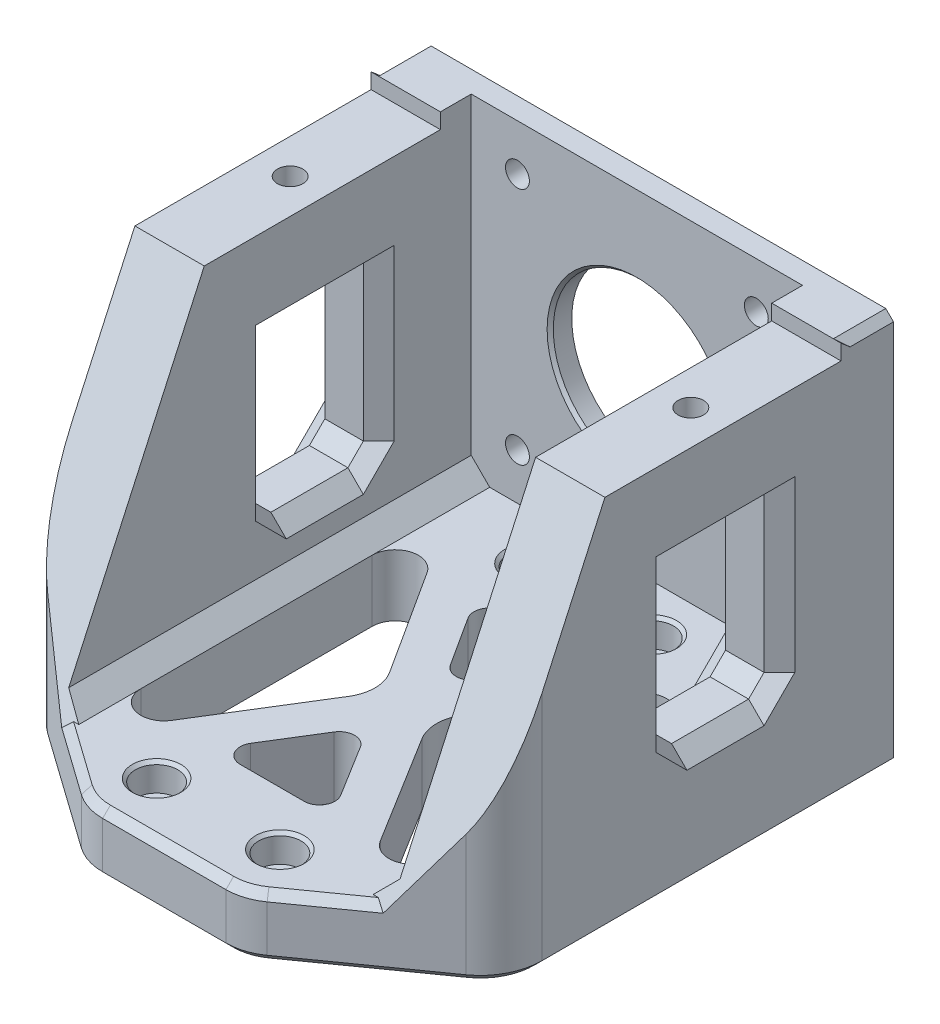
from build123d import *

# Parameters (mm, degrees)
SKETCH1_W               = 42.99999999999999
SKETCH1_H               = 43.00000000000001
SKETCH1_R               = 11.250000000000002
SKETCH1_R_2             = 1.5500000000000034
SKETCH1_R_3             = 1.5500000000000018
SKETCH1_R_4             = 1.5499999999999992
SKETCH1_R_5             = 1.5500000000000012
BOSS_EXTRUDE1_DEPTH     = 2.8
SKETCH2_R               = 1.5499999999999992
SKETCH2_R_2             = 1.5500000000000005
SKETCH2_R_3             = 1.5500000000000034
SKETCH2_R_4             = 1.5500000000000018
BOSS_EXTRUDE2_DEPTH     = 8
SKETCH3_R               = 2.75
SKETCH3_R_2             = 2.749999999999998
SKETCH3_R_3             = 2.7500000000000044
SKETCH3_R_4             = 2.7500000000000036
CUT_EXTRUDE1_DEPTH      = 3.6
SKETCH4_W               = 13.999999999999996
SKETCH4_H               = 24
BOSS_EXTRUDE3_DEPTH     = 9
CUT_EXTRUDE3_DEPTH      = 92.05990830217213
CHAMFER1_SIZE           = 2.4
BOSS_EXTRUDE4_START     = -21.5
BOSS_EXTRUDE4_DEPTH     = 43
SKETCH5_R               = 1.6499999999999986
SKETCH5_R_2             = 1.6500000000000061
CUT_EXTRUDE2_DEPTH      = 18
CUT_EXTRUDE4_DEPTH      = 2.8
CHAMFER2_SIZE           = 1
CHAMFER3_SIZE           = 1
FILLET1_R               = 2
CHAMFER4_SIZE           = 2
CHAMFER5_SIZE           = 0.4
CHAMFER6_SIZE           = 0.4
CUT_EXTRUDE5_DEPTH      = 92.05990830217213
CUT_EXTRUDE5_DEPTH_BACK = 92.05990830217213


# Read off the part's stored shape, not the designer's step: Mirror1
with BuildPart() as part:
    # Sketch1 → Boss-Extrude1 (new body)
    with BuildSketch(Plane.XY):
        with Locations((0, 29.500000000000004)):
            Rectangle(SKETCH1_W, SKETCH1_H)
        with Locations((0, 29.5)):
            Circle(SKETCH1_R, mode=Mode.SUBTRACT)
        with Locations((-15.5, 45)):
            Circle(SKETCH1_R_2, mode=Mode.SUBTRACT)
        with Locations((15.5, 45)):
            Circle(SKETCH1_R_3, mode=Mode.SUBTRACT)
        with Locations((-15.5, 14.000000000000005)):
            Circle(SKETCH1_R_4, mode=Mode.SUBTRACT)
        with Locations((15.5, 14.000000000000005)):
            Circle(SKETCH1_R_5, mode=Mode.SUBTRACT)
    extrude(amount=BOSS_EXTRUDE1_DEPTH)

    # Sketch2 → Boss-Extrude2 (add)
    with BuildSketch(Plane(origin=(0, 0, 0), x_dir=(1, 0, 0), z_dir=(0, 1, 0))):
        with BuildLine():
            Line((-21.499999999999996, 0), (21.499999999999996, 0))
            Line((21.499999999999996, 0), (21.5, -56.13000000000001))
            Line((21.5, -56.13000000000001), (12.052422437019597, -62.83770289976113))
            ThreePointArc((12.052422437019597, -62.83770289976113), (10.126743955166411, -63.79910489864743), (8.000000000000245, -64.12999999999994))
            Line((8.000000000000245, -64.12999999999994), (-7.999999999999807, -64.13))
            ThreePointArc((-7.999999999999807, -64.13), (-10.126743955165974, -63.7991048986475), (-12.052422437019167, -62.83770289976122))
            Line((-12.052422437019167, -62.83770289976122), (-21.49999999999961, -56.13000000000015))
            Line((-21.49999999999961, -56.13000000000015), (-21.499999999999996, 0))
        make_face()
        with Locations(Location((8.00000000000003, -8.800000000000002, 0), (0, 0, 270))):
            Circle(SKETCH2_R, mode=Mode.SUBTRACT)
        with Locations(Location((-7.999999999999971, -8.800000000000054, 0), (0, 0, 270))):
            Circle(SKETCH2_R_2, mode=Mode.SUBTRACT)
        with Locations(Location((-7.999999999999804, -57.13000000000005, 0), (0, 0, 270))):
            Circle(SKETCH2_R_3, mode=Mode.SUBTRACT)
        with Locations(Location((8.000000000000195, -57.13, 0), (0, 0, 270))):
            Circle(SKETCH2_R_4, mode=Mode.SUBTRACT)
        with BuildLine():
            Line((13.57707837001736, -16.445166557918895), (4.795130616695724, -30.094621381516244))
            ThreePointArc((4.795130616695724, -30.094621381516244), (4.000189021604087, -32.75652379604577), (4.748720395176192, -35.43184758707804))
            Line((4.748720395176192, -35.43184758707804), (13.549232237105649, -49.64750228125598))
            ThreePointArc((13.549232237105649, -49.64750228125598), (16.92088266863083, -50.95390090181981), (19.099999999999994, -48.06839372900919))
            Line((19.099999999999994, -48.06839372900919), (19.099999999999994, -18.06839372900918))
            ThreePointArc((19.099999999999994, -18.06839372900918), (16.945941815390423, -15.190133413302142), (13.57707837001736, -16.445166557918895))
        make_face(mode=Mode.SUBTRACT)
        with BuildLine():
            Line((5.825834789666343, -18.882151447393497), (1.681947753321832, -25.32284097156898))
            ThreePointArc((1.681947753321832, -25.32284097156898), (8.95e-14, -26.24068952417545), (-1.6819477533216585, -25.32284097156899))
            Line((-1.6819477533216585, -25.32284097156899), (-5.825834789666213, -18.88215144739354))
            ThreePointArc((-5.825834789666213, -18.88215144739354), (-5.899492757283408, -16.84195587126352), (-4.14388703634448, -15.800000000000026))
            Line((-4.14388703634448, -15.800000000000026), (4.143887036344589, -15.799999999999999))
            ThreePointArc((4.143887036344589, -15.799999999999999), (5.899492757283525, -16.841955871263476), (5.825834789666343, -18.882151447393497))
        make_face(mode=Mode.SUBTRACT)
        with BuildLine():
            Line((1.7005118419297098, -40.38700274513657), (5.844398878274272, -47.080711958695154))
            ThreePointArc((5.844398878274272, -47.080711958695154), (5.891095963414161, -49.10672431853265), (4.143887036344701, -50.13345099352635))
            Line((4.143887036344701, -50.13345099352635), (-4.14388703634435, -50.13345099352636))
            ThreePointArc((-4.14388703634435, -50.13345099352636), (-5.891095963413801, -49.10672431853265), (-5.844398878273922, -47.08071195869517))
            Line((-5.844398878273922, -47.08071195869517), (-1.7005118419294287, -40.387002745136584))
            ThreePointArc((-1.7005118419294287, -40.387002745136584), (1.3517e-13, -39.43974177996776), (1.7005118419297098, -40.38700274513657))
        make_face(mode=Mode.SUBTRACT)
        with BuildLine():
            Line((-4.748720395175949, -35.431847587078074), (-13.54923223710531, -49.64750228125607))
            ThreePointArc((-13.54923223710531, -49.64750228125607), (-16.920882668630473, -50.953900901819914), (-19.099999999999664, -48.06839372900932))
            Line((-19.099999999999664, -48.06839372900932), (-19.09999999999987, -18.068393729009312))
            ThreePointArc((-19.09999999999987, -18.068393729009312), (-16.945941815390317, -15.190133413302267), (-13.577078370017249, -16.445166557918988))
            Line((-13.577078370017249, -16.445166557918988), (-4.795130616695517, -30.094621381516276))
            ThreePointArc((-4.795130616695517, -30.094621381516276), (-4.000189021603861, -32.7565237960458), (-4.748720395175949, -35.431847587078074))
        make_face(mode=Mode.SUBTRACT)
    extrude(amount=BOSS_EXTRUDE2_DEPTH)

    # Sketch3 → Cut-Extrude1 (cut)
    with BuildSketch(Plane(origin=(0, 8, 0), x_dir=(1, 0, 0), z_dir=(0, 1, 0))):
        with Locations(Location((-7.999999999999971, -8.800000000000054, 0), (0, 0, 270))):
            Circle(SKETCH3_R)
        with Locations(Location((8.00000000000003, -8.800000000000002, 0), (0, 0, 270))):
            Circle(SKETCH3_R_2)
        with Locations(Location((-7.999999999999804, -57.13000000000005, 0), (0, 0, 270))):
            Circle(SKETCH3_R_3)
        with Locations(Location((8.000000000000195, -57.13, 0), (0, 0, 270))):
            Circle(SKETCH3_R_4)
    extrude(amount=-CUT_EXTRUDE1_DEPTH, mode=Mode.SUBTRACT)

    # Sketch4 → Boss-Extrude3 (add)
    # profile 1 of 2: a face of its own
    with BuildSketch(Plane(origin=(21.499999999999996, 0, 0), x_dir=(0, 0, -1), z_dir=(1, 0, 0))):
        Polygon((-2.8, 8), (-2.8, 51), (-6.800000000000001, 51), (-13.799999999999999, 56.99999999999999), (-33.8, 56.99999999999999), (-56.13000000000001, 8.000000000000007), align=None)
        with Locations((-21.79999999999999, 26.999999999999993)):
            Rectangle(SKETCH4_W, SKETCH4_H, mode=Mode.SUBTRACT)
    # profile 2 of 2: a face of its own
    with BuildSketch(Plane(origin=(21.499999999999996, 0, 0), x_dir=(0, 0, -1), z_dir=(1, 0, 0))):
        Polygon((0, 51), (-2.8, 51), (-2.8, 8), (-56.13000000000001, 8.000000000000007), (-56.13000000000001, 0), (0, 0), align=None)
    extrude(amount=BOSS_EXTRUDE3_DEPTH)

    # Sketch6 → Cut-Extrude3 (cut, through all)
    with BuildSketch(Plane.XZ):
        with BuildLine():
            Line((30.499999999999993, 56.13000000000001), (21.5, 56.13000000000001))
            Line((21.5, 56.13000000000001), (27.13133992802216, 52.13179464916523))
            ThreePointArc((27.13133992802216, 52.13179464916523), (29.608119280941235, 49.27948759313254), (30.499999999999993, 45.60870562086677))
            Line((30.499999999999993, 45.60870562086677), (30.499999999999993, 56.13000000000001))
        make_face()
    extrude(amount=-CUT_EXTRUDE3_DEPTH, mode=Mode.SUBTRACT)

    # Chamfer1
    # the kernel refuses this chamfer: 2.4 mm, written as the material it adds along each edge
    with BuildSketch(Plane(origin=(21.499999999999996, 8, 2.8), x_dir=(-0.9996219169112968, -0.027495876610586303, 0), z_dir=(6e-17, 0, 1))) as chamfer1_piece_1_section:
        Polygon((CHAMFER1_SIZE * 0.999621916911, -CHAMFER1_SIZE * 0.0274958766106), (-CHAMFER1_SIZE * 0.0274958766106, -CHAMFER1_SIZE * 0.999621916911), (0, 0), align=None)
    chamfer1_piece_1 = extrude(amount=59.502039171118206, mode=Mode.PRIVATE)
    chamfer1_piece_1 = split(chamfer1_piece_1, bisect_by=Plane(origin=(20.6986233607906, 18.790690338484964, 51.212528260033295), z_dir=(0, -0.4146842236388121, -0.9099653810256056)), keep=Keep.TOP, mode=Mode.PRIVATE)
    add(chamfer1_piece_1)

    # Mirror1: part across plane


with BuildPart() as part_1:
    add(part.part)
    add(part.part.mirror(Plane(origin=(0, 0, 0), x_dir=(0, 0, 1), z_dir=(1, 0, 0))))

    # Sketch7 → Boss-Extrude4 (add)
    with BuildSketch(Plane(origin=(0, 0, 0), x_dir=(0, 0, -1), z_dir=(1, 0, 0)).offset(BOSS_EXTRUDE4_START)):
        Polygon((-36.5342857142857, 50.99999999999999), (-6.800000000000001, 51), (-13.799999999999999, 56.99999999999999), (-33.8, 56.99999999999999), align=None)
    extrude(amount=BOSS_EXTRUDE4_DEPTH)

    # Sketch5 → Cut-Extrude2 (cut)
    with BuildSketch(Plane(origin=(0, 56.99999999999999, 0), x_dir=(1, 0, 0), z_dir=(0, 1, 0))):
        with Locations(Location((25.999999999999996, -21.79999999999998, 0), (0, 0, 270))):
            Circle(SKETCH5_R)
        with Locations(Location((-25.999999999999996, -21.79999999999998, 0), (0, 0, 270))):
            Circle(SKETCH5_R_2)
    extrude(amount=-CUT_EXTRUDE2_DEPTH, mode=Mode.SUBTRACT)

    # Sketch9 → Cut-Extrude4 (cut)
    with BuildSketch(Plane.XZ.offset(-38.99999999999999)):
        Polygon((25.999999999999996, 18.566838492538075), (28.8, 20.183419246269047), (28.79999999999999, 23.416580753730948), (25.999999999999993, 25.03316150746189), (23.19999999999999, 23.416580753730923), (23.2, 20.183419246269043), align=None)
        Polygon((-25.999999999999996, 18.566838492538093), (-28.8, 20.183419246269047), (-28.8, 23.416580753730944), (-25.999999999999993, 25.033161507461898), (-23.2, 23.416580753730948), (-23.2, 20.183419246269043), align=None)
    extrude(amount=-CUT_EXTRUDE4_DEPTH, mode=Mode.SUBTRACT)

    # Chamfer2
    chamfer2_edges = [part_1.edges().sort_by_distance(p)[0] for p in [
        (30.499999999999996, 0, 22.804352810433386),
        (29.608119280941235, 0, 49.27948759313254),
        (-30.499999999999996, 0, 22.804352810433386),
        (-29.608119280941235, 0, 49.27948759313254),
        (-10.12674395516598, 8, 63.7991048986475),
        (2.1849e-13, 0, 64.12999999999997),
        (10.126743955166415, 0, 63.79910489864743),
        (19.591881182520773, 0, 57.4847487744632),
        (-16.77621121850939, 8, 59.48385144988068),
        (-10.12674395516598, 0, 63.7991048986475),
        (-19.591881182520773, 0, 57.4847487744632),
        (2.1849e-13, 8, 64.12999999999997),
        (10.126743955166415, 8, 63.79910489864743),
        (16.7762112185098, 8, 59.483851449880575),
    ]]
    chamfer(chamfer2_edges, length=CHAMFER2_SIZE)

    # Chamfer3
    chamfer3_edges = [part_1.edges().sort_by_distance(p)[0] for p in [
        (30.499999999999996, 51, 3.4000000000000004),
        (-30.499999999999996, 51, 3.4000000000000004),
    ]]
    chamfer(chamfer3_edges, length=CHAMFER3_SIZE)

    # Fillet1
    fillet1_edges = [part_1.edges().sort_by_distance(p)[0] for p in [
        (0, 56.99999999999999, 33.8),
        (0, 56.99999999999999, 13.799999999999999),
    ]]
    fillet(fillet1_edges, radius=FILLET1_R)

    # Chamfer4
    chamfer4_edges = [part_1.edges().sort_by_distance(p)[0] for p in [
        (30.499999999999996, 26.999999999999993, 14.799999999999994),
        (30.499999999999996, 14.999999999999993, 21.799999999999994),
        (25.999999999999996, 14.999999999999993, 14.799999999999994),
        (30.499999999999996, 26.999999999999993, 28.799999999999994),
        (25.999999999999996, 14.999999999999993, 28.799999999999994),
        (21.499999999999996, 26.999999999999993, 28.799999999999994),
        (21.499999999999996, 14.999999999999993, 21.799999999999994),
        (21.499999999999996, 26.999999999999993, 14.799999999999994),
        (-21.499999999999996, 26.999999999999993, 28.799999999999994),
        (-21.499999999999996, 14.999999999999993, 21.799999999999994),
        (-25.999999999999996, 14.999999999999993, 28.799999999999994),
        (-21.499999999999996, 26.999999999999993, 14.799999999999994),
        (-25.999999999999996, 14.999999999999993, 14.799999999999994),
        (-30.499999999999996, 26.999999999999993, 28.799999999999994),
        (-30.499999999999996, 14.999999999999993, 21.799999999999994),
        (-30.499999999999996, 26.999999999999993, 14.799999999999994),
    ]]
    chamfer(chamfer4_edges, length=CHAMFER4_SIZE)

    # Chamfer5
    chamfer5_edges = [part_1.edges().sort_by_distance(p)[0] for p in [
        (-11.25, 29.500000000000004, 2.8),
    ]]
    chamfer(chamfer5_edges, length=CHAMFER5_SIZE)

    # Chamfer6
    chamfer6_edges = [part_1.edges().sort_by_distance(p)[0] for p in [
        (8.00000000000003, 8, 6.050000000000004),
        (-7.999999999999802, 8, 54.380000000000045),
        (8.000000000000195, 8, 54.379999999999995),
        (-7.999999999999969, 8, 6.050000000000054),
    ]]
    chamfer(chamfer6_edges, length=CHAMFER6_SIZE)

    # Sketch8 → Cut-Extrude5 (cut, two sides: drawn at the far end of the back side and taken through both)
    with BuildSketch(Plane(origin=(0, 0, 0), x_dir=(0, 0, -1), z_dir=(1, 0, 0)).offset(-CUT_EXTRUDE5_DEPTH_BACK)):
        Polygon((-6.800000000000001, 51), (-200, 50.99999999999998), (-200, 48.99999999999997), (-6.800000000000001, 48.99999999999999), align=None)
        Polygon((-200, 50.99999999999998), (-6.800000000000001, 51), (0, 51), (0, 200), (-200, 199.99999999999997), align=None)
    extrude(amount=CUT_EXTRUDE5_DEPTH + CUT_EXTRUDE5_DEPTH_BACK, mode=Mode.SUBTRACT)


solid = part_1.part
